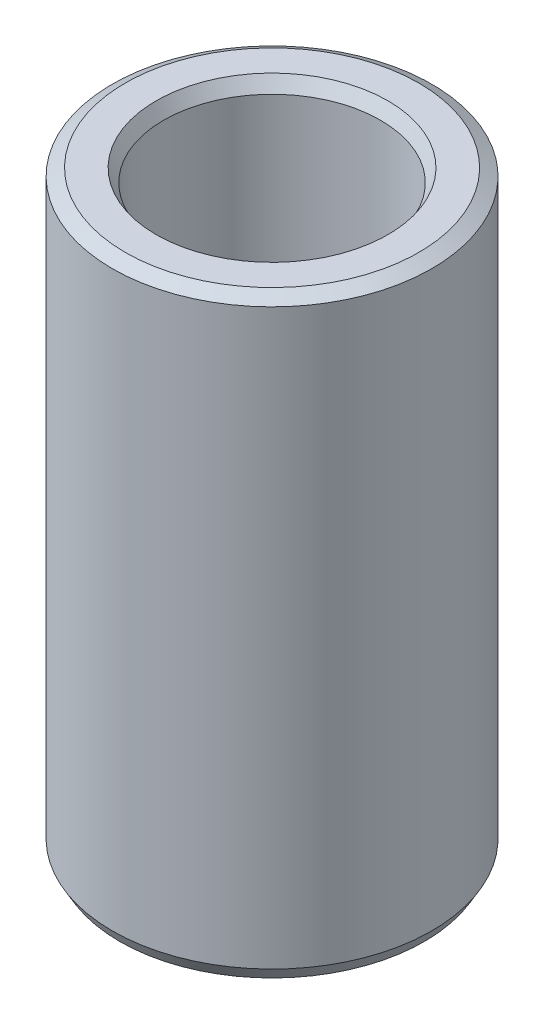
from build123d import *
from OCP.BRepFilletAPI import BRepFilletAPI_MakeChamfer

# Parameters (mm, degrees)
SKETCH1_R           = 60
BOSS_EXTRUDE1_DEPTH = 223.065249368
SKETCH2_R           = 40.711074371
CUT_EXTRUDE1_DEPTH  = 239.658973173
CHAMFER1_SIZE       = 2.823832429
CHAMFER1_SIZE2      = 4.891021239


with BuildPart() as part:
    # Sketch1 → Boss-Extrude1 (new body)
    with BuildSketch(Plane(origin=(0, 0, 0), x_dir=(1, 0, 0), z_dir=(0, 1, 0))):
        Circle(SKETCH1_R)
    extrude(amount=BOSS_EXTRUDE1_DEPTH)

    # Sketch2 → Cut-Extrude1 (cut, through all)
    with BuildSketch(Plane(origin=(0, 0, 0), x_dir=(1, 0, 0), z_dir=(0, 1, 0))):
        Circle(SKETCH2_R)
    extrude(amount=CUT_EXTRUDE1_DEPTH, mode=Mode.SUBTRACT)

    # Chamfer1: one chamfer whose edges measure the first distance from different faces: ONE call of the kernel's chamfer builder (chamfer() names one face for all edges)
    chamfer1_edges_1 = [part.edges().sort_by_distance(p)[0] for p in [
        (-40.711074371, 223.065249368, 0),
    ]]
    chamfer1_side_1 = [part.faces().sort_by_distance(p)[0] for p in [
        (-58.302943725, 223.065249368, 0),
    ]]
    chamfer1_edges_2 = [part.edges().sort_by_distance(p)[0] for p in [
        (-40.711074371, 0, 0),
    ]]
    chamfer1_side_2 = [part.faces().sort_by_distance(p)[0] for p in [
        (-40.711074371, 111.532624684, 0),
    ]]
    chamfer1_edges_3 = [part.edges().sort_by_distance(p)[0] for p in [
        (-60, 0, 0),
    ]]
    chamfer1_side_3 = [part.faces().sort_by_distance(p)[0] for p in [
        (-58.302943725, 0, 0),
    ]]
    chamfer1_edges_4 = [part.edges().sort_by_distance(p)[0] for p in [
        (-60, 223.065249368, 0),
    ]]
    chamfer1_side_4 = [part.faces().sort_by_distance(p)[0] for p in [
        (-60, 111.532624684, 0),
    ]]
    chamfer1 = BRepFilletAPI_MakeChamfer(part.part.solid().wrapped)
    for e in chamfer1_edges_1:
        chamfer1.Add(CHAMFER1_SIZE, CHAMFER1_SIZE2, e.wrapped, chamfer1_side_1[0].wrapped)  # the first distance lies on this face
    for e in chamfer1_edges_2:
        chamfer1.Add(CHAMFER1_SIZE, CHAMFER1_SIZE2, e.wrapped, chamfer1_side_2[0].wrapped)  # the first distance lies on this face
    for e in chamfer1_edges_3:
        chamfer1.Add(CHAMFER1_SIZE, CHAMFER1_SIZE2, e.wrapped, chamfer1_side_3[0].wrapped)  # the first distance lies on this face
    for e in chamfer1_edges_4:
        chamfer1.Add(CHAMFER1_SIZE, CHAMFER1_SIZE2, e.wrapped, chamfer1_side_4[0].wrapped)  # the first distance lies on this face
    add(Compound.cast(chamfer1.Shape()), mode=Mode.REPLACE)


solid = part.part
